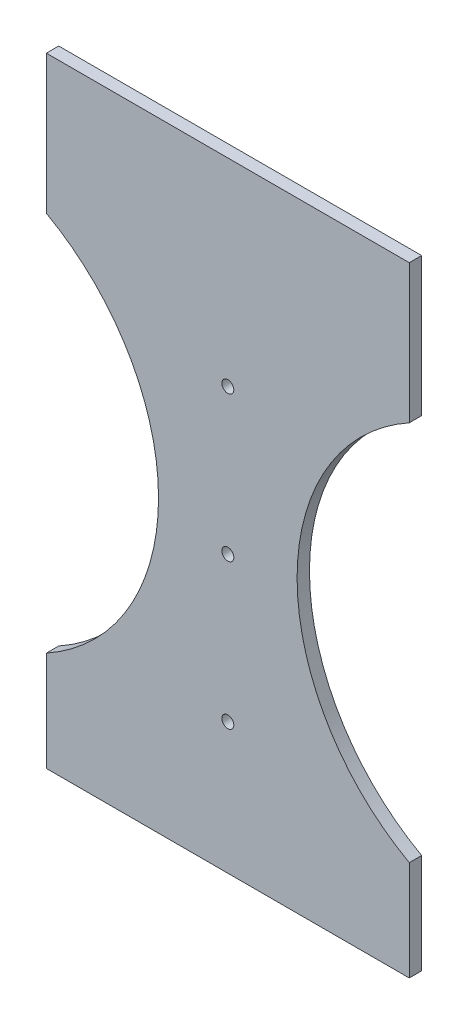
from build123d import *

# Parameters (mm, degrees)
BOSS_EXTRUDE1_DEPTH              = 11.90625
F_29_64_0_45313_DIAMETER_HOLE1_D = 11.509502


with BuildPart() as part:
    # Sketch1 → Boss-Extrude1 (new body)
    with BuildSketch(Plane.XY):
        with BuildLine():
            Line((-193.689861702, 219.800070922), (155.560138298, 219.800070922))
            Line((155.560138298, 219.800070922), (155.560138298, 86.334115981))
            ThreePointArc((155.560138298, 86.334115981), (47.610138298, -96.937929078), (155.560138298, -280.209974137))
            Line((155.560138298, -280.209974137), (155.560138298, -376.337929078))
            Line((155.560138298, -376.337929078), (-193.689861702, -376.337929078))
            Line((-193.689861702, -376.337929078), (-193.689861702, -280.209974137))
            ThreePointArc((-193.689861702, -280.209974137), (-85.739861702, -96.937929078), (-193.689861702, 86.334115981))
            Line((-193.689861702, 86.334115981), (-193.689861702, 219.800070922))
        make_face()
    extrude(amount=BOSS_EXTRUDE1_DEPTH)

    # 29/64 (0.45313) Diameter Hole1 (through all)
    with Locations(Plane.XY.offset(11.90625)):
        with Locations((-19.064861702, -250.099929078), (-19.064861702, -110.399929078), (-19.064861702, 29.300070922)):
            Hole(F_29_64_0_45313_DIAMETER_HOLE1_D / 2)


solid = part.part
